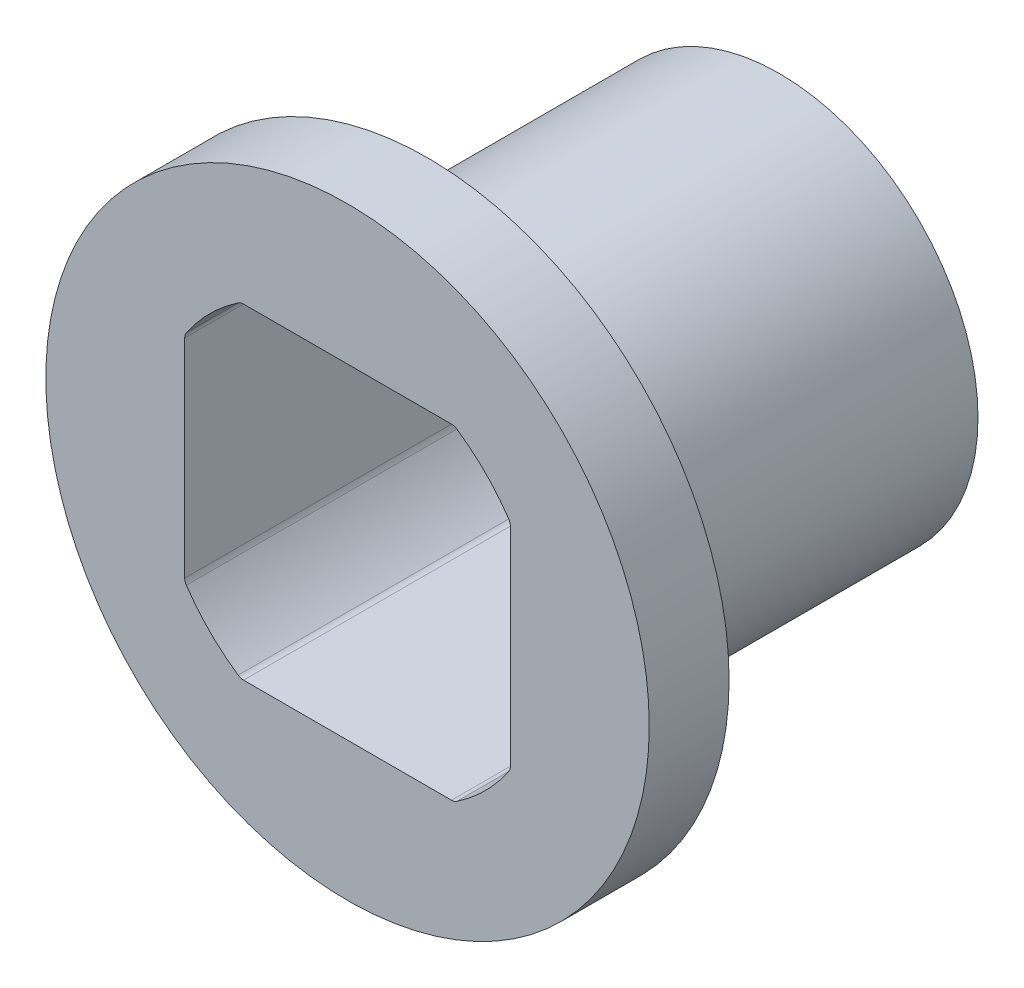
from build123d import *

# Parameters (mm, degrees)
BOSS_EXTRUDE1_OUTLINE_R = 3.9500048
BOSS_EXTRUDE1_DEPTH     = 8.5875
BOSS_EXTRUDE2_START     = -1.5875
SKETCH4_R               = 6
SKETCH4_R_2             = 3.9500048
BOSS_EXTRUDE2_DEPTH     = 1.5875


# Read off the part's stored shape, not the designer's step: Boss-Extrude1
with BuildPart() as part:
    # Boss-Extrude1 outline → Boss-Extrude1 (new body)
    with BuildSketch(Plane.XY):
        Circle(BOSS_EXTRUDE1_OUTLINE_R)
        with BuildLine():
            Line((2.067410216, -3.2385), (-2.067410216, -3.2385))
            ThreePointArc((-2.067410216, -3.2385), (-2.123342942, -3.230103762), (-2.174345227, -3.205655172))
            ThreePointArc((-2.174345227, -3.205655172), (-2.738978117, -2.738978117), (-3.205655172, -2.174345227))
            ThreePointArc((-3.205655172, -2.174345227), (-3.230103762, -2.123342942), (-3.2385, -2.067410216))
            Line((-3.2385, -2.067410216), (-3.2385, 2.067410216))
            ThreePointArc((-3.2385, 2.067410216), (-3.230103762, 2.123342942), (-3.205655172, 2.174345227))
            ThreePointArc((-3.205655172, 2.174345227), (-2.738978117, 2.738978117), (-2.174345227, 3.205655172))
            ThreePointArc((-2.174345227, 3.205655172), (-2.123342942, 3.230103762), (-2.067410216, 3.2385))
            Line((-2.067410216, 3.2385), (2.067410216, 3.2385))
            ThreePointArc((2.067410216, 3.2385), (2.123342942, 3.230103762), (2.174345227, 3.205655172))
            ThreePointArc((2.174345227, 3.205655172), (2.738978117, 2.738978117), (3.205655172, 2.174345227))
            ThreePointArc((3.205655172, 2.174345227), (3.230103762, 2.123342942), (3.2385, 2.067410216))
            Line((3.2385, 2.067410216), (3.2385, -2.067410216))
            ThreePointArc((3.2385, -2.067410216), (3.230103762, -2.123342942), (3.205655172, -2.174345227))
            ThreePointArc((3.205655172, -2.174345227), (2.738978117, -2.738978117), (2.174345227, -3.205655172))
            ThreePointArc((2.174345227, -3.205655172), (2.123342942, -3.230103762), (2.067410216, -3.2385))
        make_face(mode=Mode.SUBTRACT)
    extrude(amount=BOSS_EXTRUDE1_DEPTH)

    # Sketch4 → Boss-Extrude2 (add)
    with BuildSketch(Plane.XY.offset(8.5875).offset(BOSS_EXTRUDE2_START)):
        Circle(SKETCH4_R)
        Circle(SKETCH4_R_2, mode=Mode.SUBTRACT)
    extrude(amount=BOSS_EXTRUDE2_DEPTH)


solid = part.part
